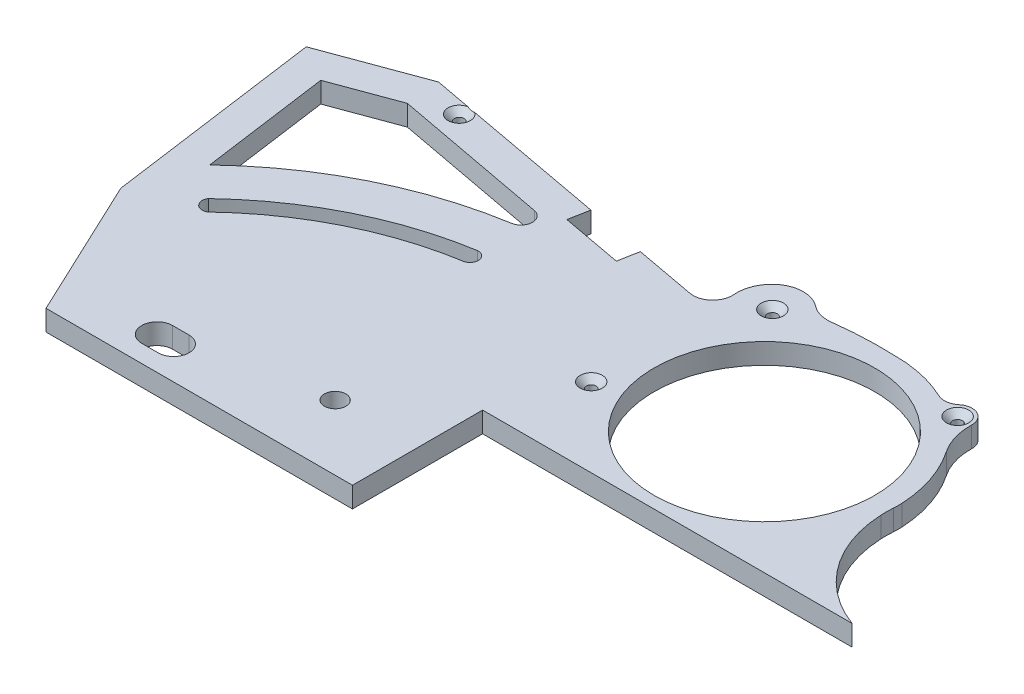
from build123d import *

# Parameters (mm, degrees)
SKETCH1_R           = 34.036
SKETCH1_R_2         = 1.524
SKETCH1_R_3         = 3.302
BOSS_EXTRUDE1_DEPTH = 6.35
CHAMFER1_SIZE       = 1.905
SKETCH2_R           = 1.1303
CUT_EXTRUDE1_DEPTH  = 12.7


with BuildPart() as part:
    # Sketch1 → Boss-Extrude1 (new body)
    with BuildSketch(Plane(origin=(0, 0, 0), x_dir=(1, 0, 0), z_dir=(0, 1, 0))):
        with BuildLine():
            Line((-48.464441263, 25.473804408), (-67.194964824, 28.947993109))
            Line((-67.194964824, 28.947993109), (-68.353027724, 22.704485256))
            Line((-68.353027724, 22.704485256), (-87.083551285, 26.178673957))
            Line((-87.083551285, 26.178673957), (-85.925488385, 32.42218181))
            Line((-85.925488385, 32.42218181), (-104.656011946, 35.896370512))
            Line((-104.656011946, 35.896370512), (-123.386535507, 39.370559213))
            Line((-123.386535507, 39.370559213), (-143.61245558, 43.122118146))
            Line((-143.61245558, 43.122118146), (-173.397808446, 32.12688033))
            Line((-173.397808446, 32.12688033), (-164.230158466, -34.209448348))
            Line((-164.230158466, -34.209448348), (-143.692879271, -77.813892282))
            Line((-143.692879271, -77.813892282), (-76.563330949, -77.813892282))
            Line((-76.563330949, -77.813892282), (-49.204879271, -77.813892282))
            Line((-49.204879271, -77.813892282), (-49.204879271, -37.681892282))
            Line((-49.204879271, -37.681892282), (45.277962712, -37.681892282))
            Line((45.277962712, -37.681892282), (64.72671994, -37.681892282))
            ThreePointArc((64.72671994, -37.681892282), (47.456106683, -24.721818432), (40.256527969, -4.364911427))
            ThreePointArc((40.256527969, -4.364911427), (40.224315343, -2.464216219), (40.304028245, -0.564920092))
            ThreePointArc((40.304028245, -0.564920092), (40.358687129, 0.79375425), (40.328560009, 2.153193811))
            ThreePointArc((40.328560009, 2.153193811), (38.274981353, 12.886225143), (33.41911498, 22.675796567))
            ThreePointArc((33.41911498, 22.675796567), (30.929713329, 27.951337515), (30.171477502, 33.73524029))
            ThreePointArc((30.171477502, 33.73524029), (27.651370412, 37.853265988), (22.862043617, 37.243820127))
            ThreePointArc((22.862043617, 37.243820127), (20.166682607, 36.055874133), (17.256896531, 36.513401897))
            ThreePointArc((17.256896531, 36.513401897), (8.843040964, 39.405959226), (0, 40.386))
            ThreePointArc((0, 40.386), (-9.489488111, 40.375548652), (-18.94466273, 39.569219451))
            ThreePointArc((-18.94466273, 39.569219451), (-22.43398811, 39.812343861), (-25.563809609, 41.373983535))
            ThreePointArc((-25.563809609, 41.373983535), (-32.045487778, 43.349075748), (-38.20024979, 40.514989348))
            ThreePointArc((-38.20024979, 40.514989348), (-40.697264896, 36.549064779), (-41.325740518, 31.904857578))
            ThreePointArc((-41.325740518, 31.904857578), (-43.308574881, 26.928241056), (-48.464441263, 25.473804408))
        make_face()
        with Locations(Location((0, 0, 0), (0, 0, 270))):
            Circle(SKETCH1_R, mode=Mode.SUBTRACT)
        with Locations(Location((-31.399492492, 33.846007028, 0), (0, 0, 270))):
            Circle(SKETCH1_R_2, mode=Mode.SUBTRACT)
        with Locations(Location((-74.604879271, -57.747892282, 0), (0, 0, 270))):
            Circle(SKETCH1_R_3, mode=Mode.SUBTRACT)
        with Locations(Location((-40.020695033, -13.367428306, 0), (0, 0, 270))):
            Circle(SKETCH1_R_2, mode=Mode.SUBTRACT)
        with Locations(Location((-131.808500509, 37.703534036, 0), (0, 0, 270))):
            Circle(SKETCH1_R_2, mode=Mode.SUBTRACT)
        with Locations(Location((25.727857837, 33.846007028, 0), (0, 0, 270))):
            Circle(SKETCH1_R_2, mode=Mode.SUBTRACT)
        with BuildLine():
            Line((-142.716614997, 32.622661546), (-162.215024971, 25.424839997))
            Line((-162.215024971, 25.424839997), (-156.726187502, -14.291916989))
            ThreePointArc((-156.726187502, -14.291916989), (-128.010283659, 5.891204619), (-94.602827713, 16.657049623))
            ThreePointArc((-94.602827713, 16.657049623), (-91.648252867, 20.09262068), (-94.526212577, 23.592621954))
            Line((-94.526212577, 23.592621954), (-142.716614997, 32.622661546))
        make_face(mode=Mode.SUBTRACT)
        with BuildLine():
            Line((-114.508797405, -72.415483536), (-119.588797405, -72.415483536))
            ThreePointArc((-119.588797405, -72.415483536), (-124.351297405, -67.652983536), (-119.588797405, -62.890483536))
            Line((-119.588797405, -62.890483536), (-114.508797405, -62.890483536))
            ThreePointArc((-114.508797405, -62.890483536), (-109.746297405, -67.652983536), (-114.508797405, -72.415483536))
        make_face(mode=Mode.SUBTRACT)
        with BuildLine():
            ThreePointArc((-147.948535824, -23.470306336), (-122.347176599, -5.47625853), (-92.563113904, 4.121916294))
            ThreePointArc((-92.563113904, 4.121916294), (-89.845720269, 1.990682905), (-91.74722838, -0.892137038))
            ThreePointArc((-91.74722838, -0.892137038), (-120.081933775, -10.023243789), (-144.437475152, -27.141662075))
            ThreePointArc((-144.437475152, -27.141662075), (-147.689154448, -26.736809805), (-147.948535824, -23.470306336))
        make_face(mode=Mode.SUBTRACT)
    extrude(amount=BOSS_EXTRUDE1_DEPTH)

    # Chamfer1
    # the kernel refuses this chamfer: 1.905 mm, written as the material it takes off along each edge
    with BuildSketch(Plane(origin=(-40.020695033, 6.35, 13.367428306), x_dir=(0, 0, 1), z_dir=(-1, 0, 0))) as chamfer1_piece_1:
        Polygon((1.524 + CHAMFER1_SIZE, 0), (1.524, -CHAMFER1_SIZE), (1.524, 0), align=None)
    revolve(axis=Axis((-40.020695033, 6.35, 13.367428306), (0, 1, 0)), mode=Mode.SUBTRACT)
    with BuildSketch(Plane(origin=(-131.808500509, 6.35, -37.703534036), x_dir=(0, 0, 1), z_dir=(-1, 0, 0))) as chamfer1_piece_2:
        Polygon((1.524 + CHAMFER1_SIZE, 0), (1.524, -CHAMFER1_SIZE), (1.524, 0), align=None)
    revolve(axis=Axis((-131.808500509, 6.35, -37.703534036), (0, 1, 0)), mode=Mode.SUBTRACT)
    with BuildSketch(Plane(origin=(25.727857837, 6.35, -33.846007028), x_dir=(0, 0, 1), z_dir=(-1, 0, 0))) as chamfer1_piece_3:
        Polygon((1.524 + CHAMFER1_SIZE, 0), (1.524, -CHAMFER1_SIZE), (1.524, 0), align=None)
    revolve(axis=Axis((25.727857837, 6.35, -33.846007028), (0, 1, 0)), mode=Mode.SUBTRACT)
    with BuildSketch(Plane(origin=(-31.399492492, 6.35, -33.846007028), x_dir=(0, 0, 1), z_dir=(-1, 0, 0))) as chamfer1_piece_4:
        Polygon((1.524 + CHAMFER1_SIZE, 0), (1.524, -CHAMFER1_SIZE), (1.524, 0), align=None)
    revolve(axis=Axis((-31.399492492, 6.35, -33.846007028), (0, 1, 0)), mode=Mode.SUBTRACT)

    # Sketch2 → Cut-Extrude1 (cut)
    with BuildSketch(Plane(origin=(1.797830768, 0, -9.692712298), x_dir=(-0.9832295832535878, 0, -0.18237211029917974), z_dir=(0.18237211029917974, 0, -0.9832295832535878))):
        with Locations((80.872383853, 3.175)):
            Circle(SKETCH2_R)
    extrude(amount=-CUT_EXTRUDE1_DEPTH, mode=Mode.SUBTRACT)


solid = part.part
